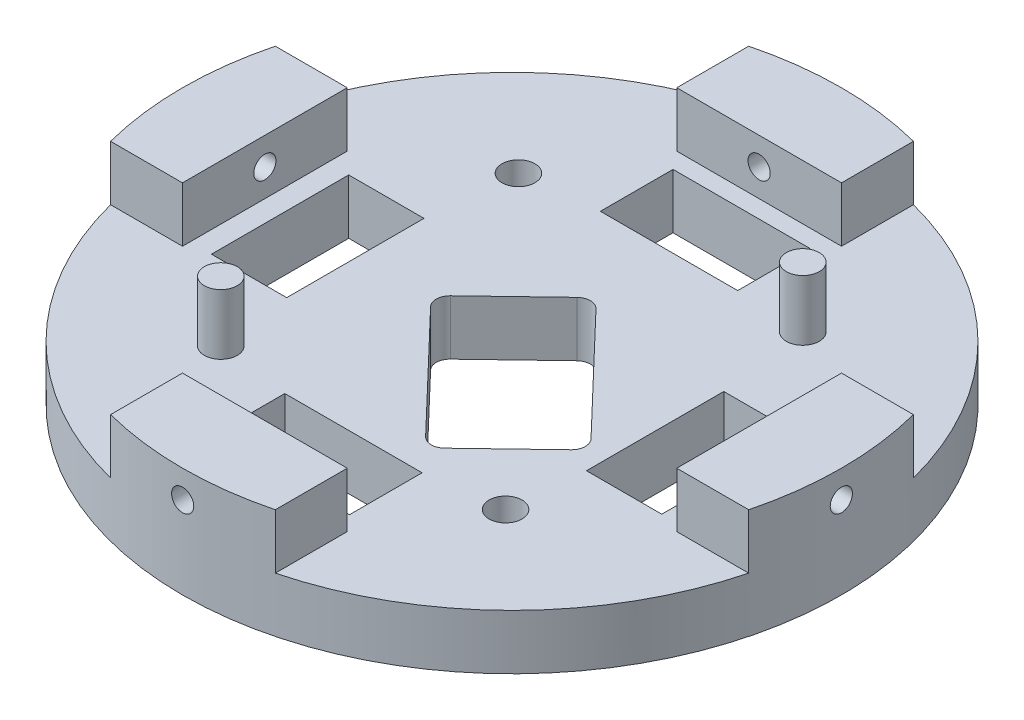
from build123d import *
from build123d.topology import SkipClean

# Parameters (mm, degrees)
SKETCH1_R           = 76.2
BOSS_EXTRUDE1_DEPTH = 12.7
SKETCH9_W           = 17.40446846
SKETCH9_H           = 31.75
SKETCH9_W_2         = 17.404468459
SKETCH9_W_3         = 31.75
SKETCH9_H_2         = 16.793136505
CUT_EXTRUDE1_DEPTH  = 12.7
SKETCH12_R          = 3.81
CUT_EXTRUDE7_DEPTH  = 109.508847566
SKETCH14_R          = 3.81
BOSS_EXTRUDE5_DEPTH = 13.97
BOSS_EXTRUDE6_DEPTH = 12.7
SKETCH15_R          = 2.5654
CUT_EXTRUDE8_DEPTH  = 156.884416797
CIRPATTERN1_COUNT   = 4
CUT_EXTRUDE9_DEPTH  = 109.664809991
FILLET1_R           = 3.175


with BuildPart() as part:
    # Sketch1 → Boss-Extrude1 (new body)
    with BuildSketch(Plane(origin=(0, 0, 0), x_dir=(1, 0, 0), z_dir=(0, 1, 0))):
        Circle(SKETCH1_R)
    extrude(amount=BOSS_EXTRUDE1_DEPTH)

    # Sketch9 → Cut-Extrude1 (cut)
    with BuildSketch(Plane(origin=(0, 12.7, 0), x_dir=(1, 0, 0), z_dir=(0, 1, 0))):
        with Locations((43.222256972, -1.420690531)):
            Rectangle(SKETCH9_W, SKETCH9_H)
        with Locations((-43.511171149, -1.420690531)):
            Rectangle(SKETCH9_W_2, SKETCH9_H)
        with Locations((0.046278064, 44.665088999)):
            Rectangle(SKETCH9_W_3, SKETCH9_H_2)
        with Locations((0.046278064, -45.105910611)):
            Rectangle(SKETCH9_W_3, SKETCH9_H_2)
    extrude(amount=-CUT_EXTRUDE1_DEPTH, mode=Mode.SUBTRACT)

    # Sketch12 → Cut-Extrude7 (cut, through all)
    with BuildSketch(Plane(origin=(0, 12.7, 0), x_dir=(1, 0, 0), z_dir=(0, 1, 0))):
        with Locations((-32.923159658, 34.412296975)):
            Circle(SKETCH12_R)
        with Locations((32.923159658, -34.412296975)):
            Circle(SKETCH12_R)
    extrude(amount=-CUT_EXTRUDE7_DEPTH, mode=Mode.SUBTRACT)

    # Sketch14 → Boss-Extrude5 (add)
    with BuildSketch(Plane(origin=(0, 12.7, 0), x_dir=(1, 0, 0), z_dir=(0, 1, 0))):
        with Locations((31.714292366, 35.529484723)):
            Circle(SKETCH14_R)
        with Locations((-32.761256964, -34.580899947)):
            Circle(SKETCH14_R)
    extrude(amount=BOSS_EXTRUDE5_DEPTH)

    # Sketch2 → Boss-Extrude6 (add)
    with BuildSketch(Plane(origin=(0, 12.7, 0), x_dir=(1, 0, 0), z_dir=(0, 1, 0))):
        with BuildLine():
            Line((-19.05, -73.780332745), (-19.05, -57.15))
            Line((-19.05, -57.15), (19.05, -57.15))
            Line((19.05, -57.15), (19.05, -73.780332745))
            ThreePointArc((19.05, -73.780332745), (0, -76.2), (-19.05, -73.780332745))
        make_face()
    boss_extrude6 = extrude(amount=BOSS_EXTRUDE6_DEPTH)

    # Sketch15 → Cut-Extrude8 (cut, through all)
    with BuildSketch(Plane(origin=(0, 0, 57.15), x_dir=(-1, 0, 0), z_dir=(0, 0, -1))):
        with Locations((0, 19.05)):
            Circle(SKETCH15_R)
    cut_extrude8 = extrude(amount=-CUT_EXTRUDE8_DEPTH, mode=Mode.SUBTRACT)

    # CirPattern1: Boss-Extrude6, Cut-Extrude8 ×4 about axis
    with SkipClean():  # the faces are left unmerged after this step: merging them gives an invalid solid
        cirpattern1_axis = Axis((0, 28.0035, 0), (0, -1, 0))
        add([boss_extrude6.rotate(cirpattern1_axis, i * 360 / CIRPATTERN1_COUNT) for i in range(1, CIRPATTERN1_COUNT)])
        add([cut_extrude8.rotate(cirpattern1_axis, i * 360 / CIRPATTERN1_COUNT) for i in range(1, CIRPATTERN1_COUNT)], mode=Mode.SUBTRACT)

    # Sketch17 → Cut-Extrude9 (cut, through all)
    with SkipClean():  # the faces are left unmerged after this step: merging them gives an invalid solid
        with BuildSketch(Plane(origin=(0, 12.7, 0), x_dir=(1, 0, 0), z_dir=(0, 1, 0))):
            Polygon((-18.552601583, -0.173564816), (11.29772984, -31.374047407), (30.843914522, -12.673692721), (0.993583099, 18.52678987), align=None)
        extrude(amount=-CUT_EXTRUDE9_DEPTH, mode=Mode.SUBTRACT)

    # Fillet1
    fillet1_edges = [part.edges().sort_by_distance(p)[0] for p in [
        (11.29772984, 6.35, 31.374047407),
        (30.843914522, 6.35, 12.673692721),
        (0.993583099, 6.35, -18.52678987),
        (-18.552601583, 6.35, 0.173564816),
    ]]
    fillet(fillet1_edges, radius=FILLET1_R)


solid = part.part
